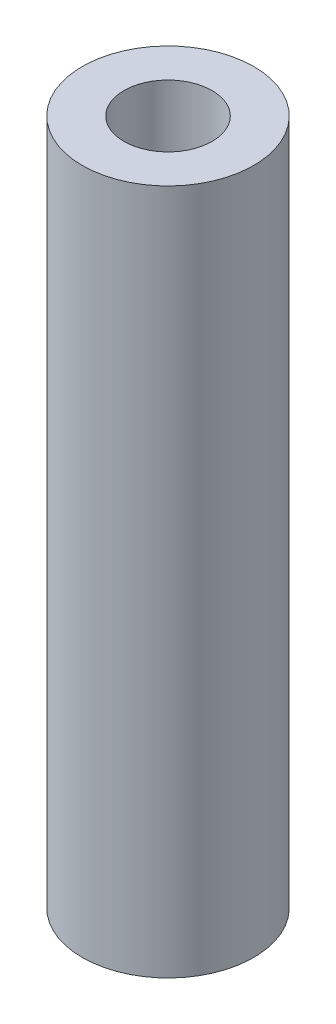
from build123d import *

# Parameters (mm, degrees)
SKETCH1_R           = 3.175
BOSS_EXTRUDE1_DEPTH = 25.4
SKETCH2_R           = 1.63195
CUT_EXTRUDE1_DEPTH  = 26.793821935


with BuildPart() as part:
    # Sketch1 → Boss-Extrude1 (new body)
    with BuildSketch(Plane(origin=(0, 0, 0), x_dir=(1, 0, 0), z_dir=(0, 1, 0))):
        Circle(SKETCH1_R)
    extrude(amount=BOSS_EXTRUDE1_DEPTH)

    # Sketch2 → Cut-Extrude1 (cut, through all)
    with BuildSketch(Plane(origin=(0, 25.4, 0), x_dir=(1, 0, 0), z_dir=(0, 1, 0))):
        Circle(SKETCH2_R)
    extrude(amount=-CUT_EXTRUDE1_DEPTH, mode=Mode.SUBTRACT)


solid = part.part
